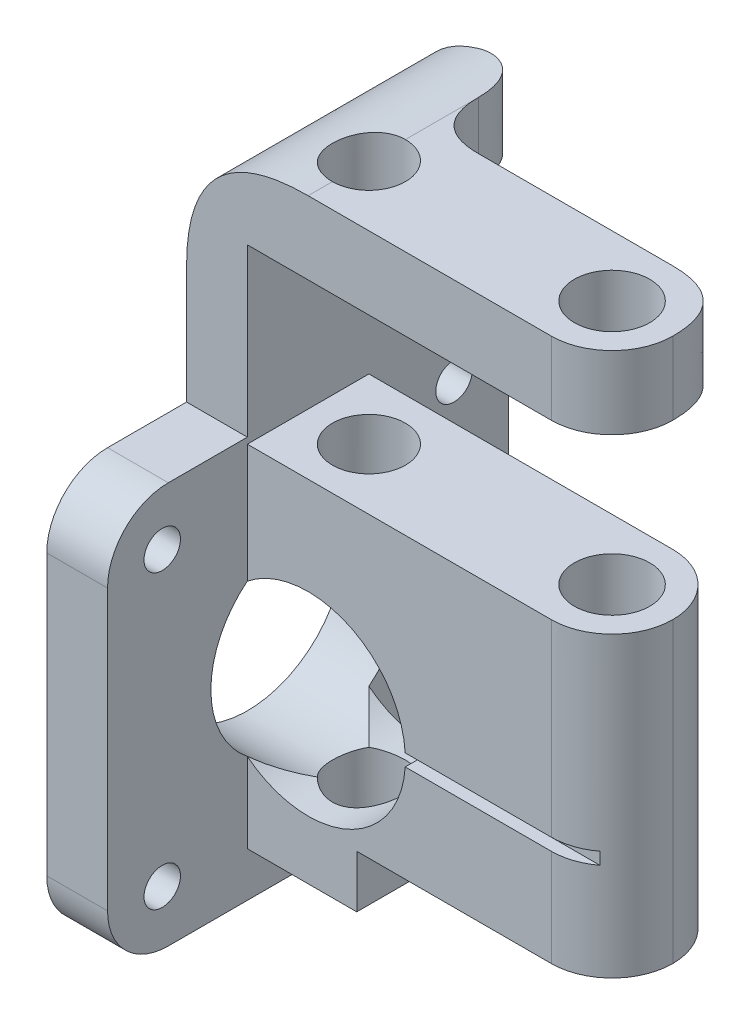
from build123d import *

# Parameters (mm, degrees)
CROQUIS1_R              = 3
CROQUIS1_R_2            = 3.1
SALIENTE_EXTRUIR1_DEPTH = 6
CROQUIS2_W              = 10
CROQUIS2_H              = 3
SALIENTE_EXTRUIR2_DEPTH = 14.2
SALIENTE_EXTRUIR3_START = 24.5
CROQUIS3_R              = 3.1
SALIENTE_EXTRUIR3_DEPTH = 24.5
CROQUIS6_R              = 8
CORTAR_EXTRUIR1_DEPTH   = 18
REDONDEO1_R             = 5
CROQUIS7_W              = 17.859034053
CROQUIS7_H              = 1
CORTAR_EXTRUIR2_DEPTH   = 1
CROQUIS8_W              = 13
CROQUIS8_H              = 6
SALIENTE_EXTRUIR4_DEPTH = 20
CROQUIS9_W              = 5
CROQUIS9_H              = 13
SALIENTE_EXTRUIR5_DEPTH = 20.2
CROQUIS10_W             = 3
CROQUIS10_H             = 14.2
CORTAR_EXTRUIR3_DEPTH   = 20
SALIENTE_EXTRUIR6_DEPTH = 5
SALIENTE_EXTRUIR7_DEPTH = 6
REDONDEO2_R             = 4
CROQUIS13_W             = 15
CROQUIS13_H             = 24.5
CORTAR_EXTRUIR4_DEPTH   = 11
REDONDEO3_R             = 4
REDONDEO4_R             = 5
REDONDEO9_SIZE          = 10
CROQUIS15_W             = 23.51054635
CROQUIS15_H             = 8.430737454
CORTAR_EXTRUIR6_DEPTH   = 12.311914061
REDONDEO10_R            = 5
CROQUIS16_W             = 33
CROQUIS16_H             = 33
SALIENTE_EXTRUIR8_DEPTH = 5
CROQUIS18_R             = 1.5
CORTAR_EXTRUIR7_DEPTH   = 10
CROQUIS19_R             = 8
CORTAR_EXTRUIR8_DEPTH   = 10
REDONDEO13_R            = 5
REDONDEO14_R            = 5
REDONDEO15_R            = 5
REDONDEO17_SIZE         = 3
CROQUIS20_W             = 26.447439695
CROQUIS20_H             = 7.153283898
CORTAR_EXTRUIR9_DEPTH   = 8
REDONDEO18_DEPTH        = 6
REDONDEO19_SIZE         = 4
REDONDEO20_SIZE         = 5
CROQUIS21_W             = 10
CROQUIS21_H             = 4.320063387
SALIENTE_EXTRUIR9_DEPTH = 9
CROQUIS14_R             = 3
CORTAR_EXTRUIR5_DEPTH   = 59


with BuildPart() as part:
    # Croquis1 → Saliente-Extruir1 (new body)
    with BuildSketch(Plane(origin=(0, 0, 0), x_dir=(1, 0, 0), z_dir=(0, 1, 0))):
        with BuildLine():
            Line((-5, 20), (-5, 0))
            ThreePointArc((-5, 0), (0, -5), (5, 0))
            Line((5, 0), (5, 20))
            ThreePointArc((5, 20), (0, 25), (-5, 20))
        make_face()
        with Locations(Location((0, 20, 0), (0, 0, 270))):
            Circle(CROQUIS1_R, mode=Mode.SUBTRACT)
        with Locations(Location((0, 0, 0), (0, 0, 270))):
            Circle(CROQUIS1_R_2, mode=Mode.SUBTRACT)
    extrude(amount=SALIENTE_EXTRUIR1_DEPTH)

    # Croquis2 → Saliente-Extruir2 (add)
    with BuildSketch(Plane.XZ):
        with Locations((0, -14.5)):
            Rectangle(CROQUIS2_W, CROQUIS2_H)
    extrude(amount=SALIENTE_EXTRUIR2_DEPTH)

    # Croquis3 → Saliente-Extruir3 (add)
    with BuildSketch(Plane.XZ.offset(14.2).offset(SALIENTE_EXTRUIR3_START)):
        with BuildLine():
            Line((-5, -5), (-5, -16))
            Line((-5, -16), (5, -16))
            Line((5, -16), (5, 0))
            ThreePointArc((5, 0), (3.535533906, 3.535533906), (0, 5))
            Line((0, 5), (-30, 5))
            Line((-30, 5), (-30, -5))
            Line((-30, -5), (-5, -5))
        make_face()
        with Locations(Location((0, 0, 0), (0, 0, 90))):
            Circle(CROQUIS3_R, mode=Mode.SUBTRACT)
    extrude(amount=-SALIENTE_EXTRUIR3_DEPTH)

    # Croquis6 → Cortar-Extruir1 (cut)
    with BuildSketch(Plane.XY.offset(5)):
        with Locations((-20, -30.2)):
            Circle(CROQUIS6_R)
    extrude(amount=-CORTAR_EXTRUIR1_DEPTH, mode=Mode.SUBTRACT)

    # Redondeo1
    redondeo1_edges = [part.edges().sort_by_distance(p)[0] for p in [
        (-5, -26.45, -5),
    ]]
    fillet(redondeo1_edges, radius=REDONDEO1_R)

    # Croquis7 → Cortar-Extruir2 (cut)
    with BuildSketch(Plane.XY.offset(5)):
        with Locations((-3.905990917, -30.2)):
            Rectangle(CROQUIS7_W, CROQUIS7_H)
    extrude(amount=-CORTAR_EXTRUIR2_DEPTH, mode=Mode.SUBTRACT)

    # Croquis8 → Saliente-Extruir4 (add)
    with BuildSketch(Plane.ZY.offset(5)):
        with Locations((-6.5, 3)):
            Rectangle(CROQUIS8_W, CROQUIS8_H)
    extrude(amount=SALIENTE_EXTRUIR4_DEPTH)

    # Croquis9 → Saliente-Extruir5 (add)
    with BuildSketch(Plane(origin=(0, 6, 0), x_dir=(1, 0, 0), z_dir=(0, 1, 0))):
        with Locations((-27.5, 6.5)):
            Rectangle(CROQUIS9_W, CROQUIS9_H)
    extrude(amount=-SALIENTE_EXTRUIR5_DEPTH)

    # Croquis10 → Cortar-Extruir3 (cut)
    with BuildSketch(Plane.ZY.offset(5)):
        with Locations((-14.5, -7.1)):
            Rectangle(CROQUIS10_W, CROQUIS10_H)
    extrude(amount=-CORTAR_EXTRUIR3_DEPTH, mode=Mode.SUBTRACT)

    # Croquis11 → Saliente-Extruir6 (add)
    with BuildSketch(Plane.XY):
        Polygon((-5, 0), (-5, 6), (-30, 6), (-30, -14.2), (-25, -14.2), (-25, 0), align=None)
    extrude(amount=SALIENTE_EXTRUIR6_DEPTH)

    # Croquis12 → Saliente-Extruir7 (add)
    with BuildSketch(Plane(origin=(0, 6, 0), x_dir=(1, 0, 0), z_dir=(0, 1, 0))):
        Polygon((-5, -5), (0, -5), (-4.695965468, 0.35178881), (-6.407055534, -0.228241721), align=None)
    extrude(amount=-SALIENTE_EXTRUIR7_DEPTH)

    # Redondeo2
    # the kernel refuses this fillet: 4 mm, written as the material it adds along each edge
    with BuildSketch(Plane(origin=(-30, -14.2, -5), x_dir=(0, 0, -1), z_dir=(1, 0, 0))) as redondeo2_piece_1:
        with BuildLine():
            CenterArc((REDONDEO2_R, -REDONDEO2_R), REDONDEO2_R, 90, 90)
            Line((0, -REDONDEO2_R), (0, 0))
            Line((0, 0), (REDONDEO2_R, 0))
        make_face()
    extrude(amount=5)

    # Croquis13 → Cortar-Extruir4 (cut)
    with BuildSketch(Plane(origin=(0, 0, -16), x_dir=(-1, 0, 0), z_dir=(0, 0, -1))):
        with Locations((2.5, -26.45)):
            Rectangle(CROQUIS13_W, CROQUIS13_H)
    extrude(amount=-CORTAR_EXTRUIR4_DEPTH, mode=Mode.SUBTRACT)

    # Redondeo3
    redondeo3_edges = [part.edges().sort_by_distance(p)[0] for p in [
        (-5, 3, -13),
    ]]
    fillet(redondeo3_edges, radius=REDONDEO3_R)

    # Redondeo4
    redondeo4_edges = [part.edges().sort_by_distance(p)[0] for p in [
        (5, -26.45, -5),
    ]]
    fillet(redondeo4_edges, radius=REDONDEO4_R - 0.0001)  # a hair under: the kernel refuses the full size

    # Redondeo9
    # a fillet whose section is not a circle: 10 mm, written as the material it takes off along each edge
    with BuildSketch(Plane(origin=(-30, 6, 30), x_dir=(0, -1, 0), z_dir=(0, 0, -1))) as redondeo9_piece_1:
        with BuildLine():
            Bezier((REDONDEO9_SIZE, 0), (0, 0), (0, -REDONDEO9_SIZE), weights=[1, 1, 1])
            Line((0, -REDONDEO9_SIZE), (0, 0))
            Line((0, 0), (REDONDEO9_SIZE, 0))
        make_face()
    extrude(amount=68, mode=Mode.SUBTRACT)

    # Croquis15 → Cortar-Extruir6 (cut)
    with BuildSketch(Plane.XY.offset(-25.311914061)):
        with Locations((-4.843890072, 4.215368727)):
            Rectangle(CROQUIS15_W, CROQUIS15_H)
    extrude(amount=CORTAR_EXTRUIR6_DEPTH, mode=Mode.SUBTRACT)

    # Redondeo10
    redondeo10_edges = [part.edges().sort_by_distance(p)[0] for p in [
        (5, 3, -13),
    ]]
    fillet(redondeo10_edges, radius=REDONDEO10_R)

    # Croquis16 → Saliente-Extruir8 (add)
    with BuildSketch(Plane.ZY.offset(30)):
        with Locations((0, -30.2)):
            Rectangle(CROQUIS16_W, CROQUIS16_H)
    extrude(amount=-SALIENTE_EXTRUIR8_DEPTH)

    # Croquis18 → Cortar-Extruir7 (cut)
    with BuildSketch(Plane.ZY.offset(30)):
        with Locations((12, -42.2)):
            Circle(CROQUIS18_R)
        with Locations((-12, -42.2)):
            Circle(CROQUIS18_R)
        with Locations((-12, -18.2)):
            Circle(CROQUIS18_R)
        with Locations((12, -18.2)):
            Circle(CROQUIS18_R)
    extrude(amount=-CORTAR_EXTRUIR7_DEPTH, mode=Mode.SUBTRACT)

    # Croquis19 → Cortar-Extruir8 (cut)
    with BuildSketch(Plane.ZY.offset(30)):
        with Locations((0, -30.2)):
            Circle(CROQUIS19_R)
    extrude(amount=-CORTAR_EXTRUIR8_DEPTH, mode=Mode.SUBTRACT)

    # Redondeo13
    redondeo13_edges = [part.edges().sort_by_distance(p)[0] for p in [
        (-27.5, -13.7, 16.5),
    ]]
    fillet(redondeo13_edges, radius=REDONDEO13_R)

    # Redondeo14
    redondeo14_edges = [part.edges().sort_by_distance(p)[0] for p in [
        (-27.5, -46.7, 16.5),
    ]]
    fillet(redondeo14_edges, radius=REDONDEO14_R)

    # Redondeo15
    redondeo15_edges = [part.edges().sort_by_distance(p)[0] for p in [
        (-27.5, -46.7, -16.5),
    ]]
    fillet(redondeo15_edges, radius=REDONDEO15_R)

    # Redondeo17
    # a fillet whose section is not a circle: 3 mm, written as the material it takes off along each edge
    with BuildSketch(Plane(origin=(-37.5, -13.7, -16.5), x_dir=(0, -1, 0), z_dir=(1, 0, 0))) as redondeo17_piece_1:
        with BuildLine():
            Bezier((REDONDEO17_SIZE, 0), (0, 0), (0, -REDONDEO17_SIZE), weights=[1, 1, 1])
            Line((0, -REDONDEO17_SIZE), (0, 0))
            Line((0, 0), (REDONDEO17_SIZE, 0))
        make_face()
    extrude(amount=20, mode=Mode.SUBTRACT)

    # Croquis20 → Cortar-Extruir9 (cut)
    with BuildSketch(Plane(origin=(0, 0, -13), x_dir=(-1, 0, 0), z_dir=(0, 0, -1))):
        with Locations((6.776280153, 2.423358051)):
            Rectangle(CROQUIS20_W, CROQUIS20_H)
    extrude(amount=-CORTAR_EXTRUIR9_DEPTH, mode=Mode.SUBTRACT)

    # Redondeo18: read off the stored shape, not the designer's step
    # Redondeo18 outline → Redondeo18 (add)
    with BuildSketch(Plane(origin=(0, 0, 0), x_dir=(1, 0, 0), z_dir=(0, 1, 0))):
        with BuildLine():
            Line((-20, 5), (-16, 5))
            add(Edge.make_bspline(
                [(-16, 5), (-20, 5), (-20, 9)],
                knots=[0, 0, 0, 1, 1, 1], degree=2))
            Line((-20, 9), (-20, 5))
        make_face()
    extrude(amount=REDONDEO18_DEPTH)

    # Redondeo19
    # a fillet whose section is not a circle: 4 mm, written as the material it takes off along each edge
    with BuildSketch(Plane(origin=(-20, -10, -13), x_dir=(0, 0, 1), z_dir=(0, 1, 0))) as redondeo19_piece_1:
        with BuildLine():
            Bezier((REDONDEO19_SIZE, 0), (0, 0), (0, -REDONDEO19_SIZE), weights=[1, 1, 1])
            Line((0, -REDONDEO19_SIZE), (0, 0))
            Line((0, 0), (REDONDEO19_SIZE, 0))
        make_face()
    extrude(amount=26, mode=Mode.SUBTRACT)

    # Redondeo20
    # a fillet whose section is not a circle: 5 mm, written as the material it takes off along each edge
    with BuildSketch(Plane(origin=(5, 18.5, -5), x_dir=(-1, 0, 0), z_dir=(0, -1, 0))) as redondeo20_piece_1:
        with BuildLine():
            Bezier((REDONDEO20_SIZE, 0), (0, 0), (0, -REDONDEO20_SIZE), weights=[1, 1, 1])
            Line((0, -REDONDEO20_SIZE), (0, 0))
            Line((0, 0), (REDONDEO20_SIZE, 0))
        make_face()
    extrude(amount=31, mode=Mode.SUBTRACT)

    # Croquis21 → Saliente-Extruir9 (add)
    with BuildSketch(Plane(origin=(-25, 0, 0), x_dir=(0, 0, -1), z_dir=(1, 0, 0))):
        with Locations((0, -40.860031694)):
            Rectangle(CROQUIS21_W, CROQUIS21_H)
    extrude(amount=SALIENTE_EXTRUIR9_DEPTH)

    # Croquis14 → Cortar-Extruir5 (cut)
    with BuildSketch(Plane(origin=(0, 6, 0), x_dir=(1, 0, 0), z_dir=(0, 1, 0))):
        with Locations(Location((-20, 0, 0), (0, 0, 270))):
            Circle(CROQUIS14_R)
    extrude(amount=-CORTAR_EXTRUIR5_DEPTH, mode=Mode.SUBTRACT)


solid = part.part
